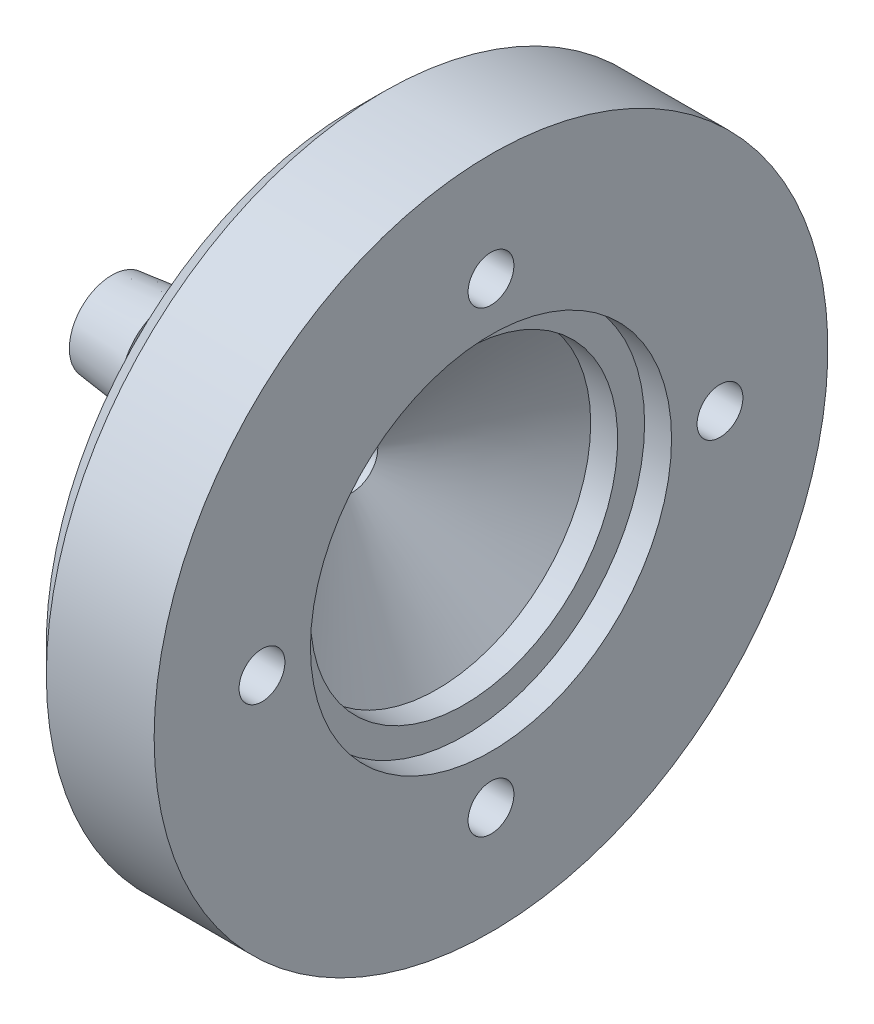
from build123d import *

# Parameters (mm, degrees)
CBORE_FOR_M3_HEX_SOCKET_HEAD_CAP_SCREW2_D           = 3.4
CBORE_FOR_M3_HEX_SOCKET_HEAD_CAP_SCREW2_DEPTH       = 10
CBORE_FOR_M3_HEX_SOCKET_HEAD_CAP_SCREW2_CBORE_D     = 6.5
CBORE_FOR_M3_HEX_SOCKET_HEAD_CAP_SCREW2_CBORE_DEPTH = 3.4
CBORE_FOR_M3_HEX_SOCKET_HEAD_CAP_SCREW2_TIP         = 1.021463052
CHAMFER1_SIZE                                       = 2


with BuildPart() as part:
    # Sketch1 → Revolve17 (revolve)
    with BuildSketch(Plane.XY):
        Polygon((-13.50584799, 3.65), (-13.50584799, 3.15), (-9.172514657, 3.65), (-9.172514657, 3.15), (-4.839181323, 3.65), (0.301587102, 11.4), (0.301587102, 25), (10.301587102, 25), (10.301587102, 13.4), (8.301587102, 13.4), (8.301587102, 11.4), (6.301587102, 11.4), (0, 1.9), (-17.839181323, 1.9), (-17.839181323, 3.15), align=None)
    revolve(axis=Axis((-801.920554309, 0, 0), (1, 0, 0)))

    # CBORE for M3 Hex Socket Head Cap Screw2
    with Locations(Plane.ZY.offset(-0.301587102)):
        with Locations((0, -16.994664238), (0, 16.994664238), (16.994664238, 0), (-16.994664238, 0)):
            CounterBoreHole(CBORE_FOR_M3_HEX_SOCKET_HEAD_CAP_SCREW2_D / 2, CBORE_FOR_M3_HEX_SOCKET_HEAD_CAP_SCREW2_CBORE_D / 2, CBORE_FOR_M3_HEX_SOCKET_HEAD_CAP_SCREW2_CBORE_DEPTH, depth=CBORE_FOR_M3_HEX_SOCKET_HEAD_CAP_SCREW2_DEPTH)
            with Locations((0, 0, -(CBORE_FOR_M3_HEX_SOCKET_HEAD_CAP_SCREW2_DEPTH + CBORE_FOR_M3_HEX_SOCKET_HEAD_CAP_SCREW2_TIP / 2))):  # 118° drill point
                Cone(0, CBORE_FOR_M3_HEX_SOCKET_HEAD_CAP_SCREW2_D / 2, CBORE_FOR_M3_HEX_SOCKET_HEAD_CAP_SCREW2_TIP, mode=Mode.SUBTRACT)

    # Chamfer1
    chamfer1_edges = [part.edges().sort_by_distance(p)[0] for p in [
        (0.301587102, -25, 0),
    ]]
    chamfer(chamfer1_edges, length=CHAMFER1_SIZE)


solid = part.part
